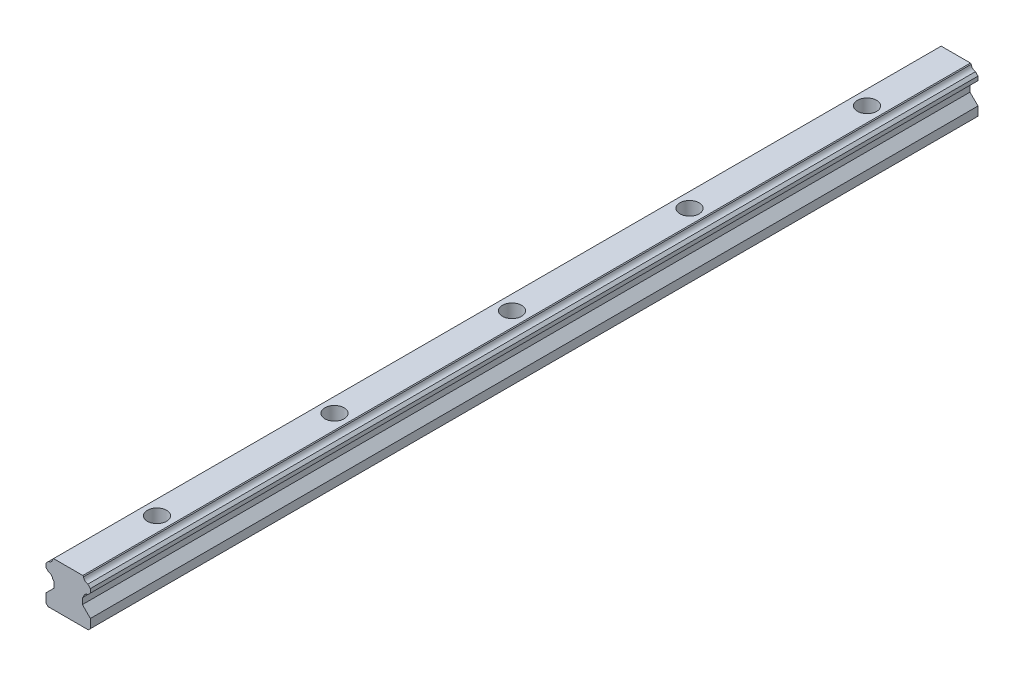
from build123d import *

# Parameters (mm, degrees)
EXTRUDE_1_DEPTH     = 300
SKETCH_2_R          = 3.25
CUT_EXTRUDE_1_DEPTH = 5.3
SKETCH_3_R          = 2.25
CUT_EXTRUDE_2_DEPTH = 301.250462115


with BuildPart() as part:
    # Model → Бобышка-Вытянуть1 (new body)
    with BuildSketch(Plane.XY):
        with BuildLine():
            Line((6.8, 0), (7.5, 0.7))
            Line((7.5, 0.7), (7.5, 3.6994391))
            Line((7.5, 3.6994391), (4.7998047, 6.3996344))
            Line((4.7998047, 6.3996344), (4.7998047, 8.409149262))
            Line((4.7998047, 8.409149262), (5.20075838, 8.810103152))
            ThreePointArc((5.20075838, 8.810103152), (5.668922208, 9.789261508), (6.648080611, 10.257425237))
            Line((6.648080611, 10.257425237), (7.5, 11.109345046))
            Line((7.5, 11.109345046), (7.5, 12.449454443))
            Line((7.5, 12.449454443), (6.634490912, 13.314965186))
            ThreePointArc((6.634490912, 13.314965186), (5.668922174, 13.781617126), (5.202270193, 14.747185846))
            Line((5.202270193, 14.747185846), (4.949456226, 15))
            Line((4.949456226, 15), (-4.949456226, 15))
            Line((-4.949456226, 15), (-5.202270193, 14.747185846))
            ThreePointArc((-5.202270193, 14.747185846), (-5.668922174, 13.781617126), (-6.634490912, 13.314965186))
            Line((-6.634490912, 13.314965186), (-7.5, 12.449454443))
            Line((-7.5, 12.449454443), (-7.5, 11.109345046))
            Line((-7.5, 11.109345046), (-6.648080611, 10.257425238))
            ThreePointArc((-6.648080611, 10.257425238), (-5.668922208, 9.789261508), (-5.20075838, 8.810103152))
            Line((-5.20075838, 8.810103152), (-4.7998047, 8.409149262))
            Line((-4.7998047, 8.409149262), (-4.7998047, 6.3996344))
            Line((-4.7998047, 6.3996344), (-7.5, 3.6994391))
            Line((-7.5, 3.6994391), (-7.5, 0.7))
            Line((-7.5, 0.7), (-6.8, 0))
            Line((-6.8, 0), (6.8, 0))
        make_face()
    extrude(amount=EXTRUDE_1_DEPTH)

    # Эскиз2 → Вырез-Вытянуть1 (cut)
    with BuildSketch(Plane(origin=(0, 15, 0), x_dir=(1, 0, 0), z_dir=(0, 1, 0))):
        with Locations((0, -30)):
            Circle(SKETCH_2_R)
        with Locations((0, -90)):
            Circle(SKETCH_2_R)
        with Locations((0, -150)):
            Circle(SKETCH_2_R)
        with Locations((0, -210)):
            Circle(SKETCH_2_R)
        with Locations((0, -270)):
            Circle(SKETCH_2_R)
        with Locations((0, -330)):
            Circle(SKETCH_2_R)
        with Locations((0, -390)):
            Circle(SKETCH_2_R)
        with Locations((0, -450)):
            Circle(SKETCH_2_R)
        with Locations((0, -510)):
            Circle(SKETCH_2_R)
        with Locations((0, -570)):
            Circle(SKETCH_2_R)
    extrude(amount=-CUT_EXTRUDE_1_DEPTH, mode=Mode.SUBTRACT)

    # Эскиз3 → Вырез-Вытянуть2 (cut, through all)
    with BuildSketch(Plane(origin=(0, 9.7, 0), x_dir=(1, 0, 0), z_dir=(0, 1, 0))):
        with Locations((0, -30)):
            Circle(SKETCH_3_R)
        with Locations((0, -90)):
            Circle(SKETCH_3_R)
        with Locations((0, -150)):
            Circle(SKETCH_3_R)
        with Locations((0, -210)):
            Circle(SKETCH_3_R)
        with Locations((0, -270)):
            Circle(SKETCH_3_R)
        with Locations((0, -330)):
            Circle(SKETCH_3_R)
        with Locations((0, -390)):
            Circle(SKETCH_3_R)
        with Locations((0, -450)):
            Circle(SKETCH_3_R)
        with Locations((0, -510)):
            Circle(SKETCH_3_R)
        with Locations((0, -570)):
            Circle(SKETCH_3_R)
    extrude(amount=-CUT_EXTRUDE_2_DEPTH, mode=Mode.SUBTRACT)


solid = part.part
